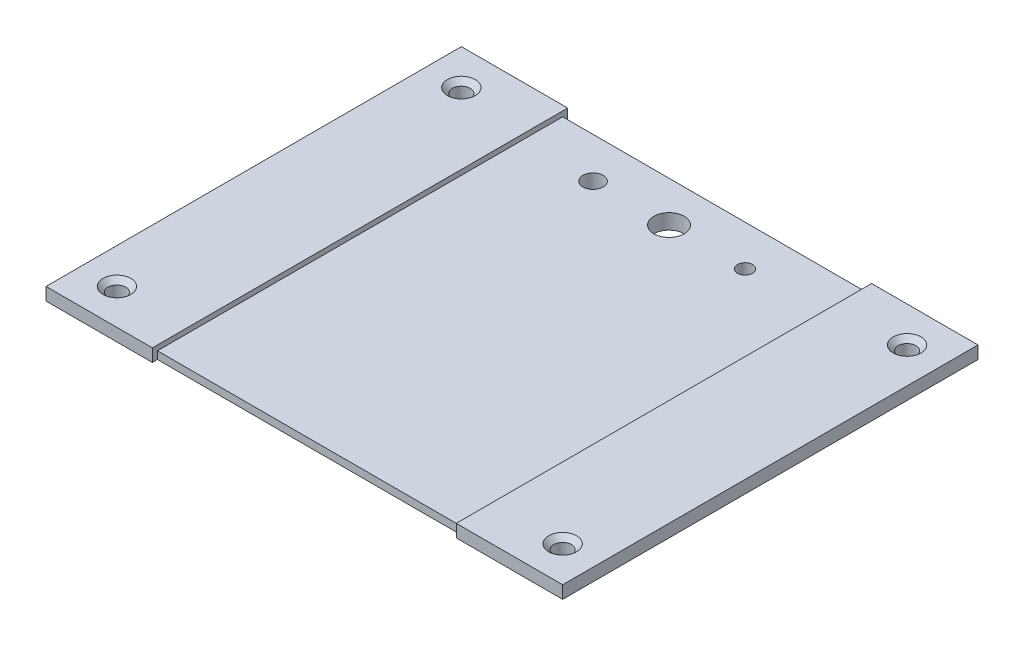
from build123d import *

# Parameters (mm, degrees)
ESQUISSE1_W             = 102
ESQUISSE1_H             = 80
BOSS_EXTRU_1_DEPTH      = 1.5
ESQUISSE2_W             = 96
ESQUISSE2_H             = 76
BOSS_EXTRU_2_DEPTH      = 1.5
ESQUISSE3_R             = 1.75
ESQUISSE3_R_2           = 2
ESQUISSE3_R_3           = 3
ESQUISSE3_R_4           = 1.5
ENL_V_MAT_EXTRU_1_DEPTH = 5
BOSS_EXTRU_5_START      = 1
ESQUISSE6_W             = 21
ESQUISSE6_H             = 80
ESQUISSE6_R             = 1.75
BOSS_EXTRU_5_DEPTH      = 1
CHANFREIN2_SIZE         = 1
ESQUISSE7_W             = 21
ESQUISSE7_H             = 2.5
BOSS_EXTRU_6_DEPTH      = 1
ESQUISSE8_W             = 21
ESQUISSE8_H             = 2.5
BOSS_EXTRU_7_DEPTH      = 1


with BuildPart() as part:
    # Esquisse1 → Boss.-Extru.1 (new body)
    with BuildSketch(Plane(origin=(0, 0, 0), x_dir=(1, 0, 0), z_dir=(0, 1, 0))):
        with Locations((51, 40)):
            Rectangle(ESQUISSE1_W, ESQUISSE1_H)
    extrude(amount=BOSS_EXTRU_1_DEPTH)

    # Esquisse2 → Boss.-Extru.2 (add)
    with BuildSketch(Plane.XZ):
        with Locations((51, -40)):
            Rectangle(ESQUISSE2_W, ESQUISSE2_H)
    extrude(amount=BOSS_EXTRU_2_DEPTH)

    # Esquisse3 → Enlèv. mat.-Extru.1 (cut)
    with BuildSketch(Plane(origin=(0, 1.5, 0), x_dir=(1, 0, 0), z_dir=(0, 1, 0))):
        with Locations((7, 74)):
            Circle(ESQUISSE3_R)
        with Locations((7, 6)):
            Circle(ESQUISSE3_R)
        with Locations((95, 6)):
            Circle(ESQUISSE3_R)
        with Locations((95, 74)):
            Circle(ESQUISSE3_R)
        with Locations((35, 72)):
            Circle(ESQUISSE3_R_2)
        with Locations((50, 72)):
            Circle(ESQUISSE3_R_3)
        with Locations((65, 72)):
            Circle(ESQUISSE3_R_4)
    extrude(amount=-ENL_V_MAT_EXTRU_1_DEPTH, mode=Mode.SUBTRACT)

    # Esquisse6 → Boss.-Extru.5 (add)
    # profile 1 of 2: a face of its own
    with BuildSketch(Plane(origin=(0, 1.5, 0), x_dir=(1, 0, 0), z_dir=(0, 1, 0)).offset(BOSS_EXTRU_5_START)):
        with Locations((91.5, 40)):
            Rectangle(ESQUISSE6_W, ESQUISSE6_H)
        with Locations((95, 6)):
            Circle(ESQUISSE6_R, mode=Mode.SUBTRACT)
        with Locations((95, 74)):
            Circle(ESQUISSE6_R, mode=Mode.SUBTRACT)
    # profile 2 of 2: a face of its own
    with BuildSketch(Plane(origin=(0, 1.5, 0), x_dir=(1, 0, 0), z_dir=(0, 1, 0)).offset(BOSS_EXTRU_5_START)):
        with Locations((10.5, 40)):
            Rectangle(ESQUISSE6_W, ESQUISSE6_H)
        with Locations((7, 74)):
            Circle(ESQUISSE6_R, mode=Mode.SUBTRACT)
        with Locations((7, 6)):
            Circle(ESQUISSE6_R, mode=Mode.SUBTRACT)
    extrude(amount=-BOSS_EXTRU_5_DEPTH)

    # Chanfrein2
    chanfrein2_edges = [part.edges().sort_by_distance(p)[0] for p in [
        (5.25, 2.5, -74),
        (5.25, 2.5, -6),
        (93.25, 2.5, -6),
        (93.25, 2.5, -74),
    ]]
    chamfer(chanfrein2_edges, length=CHANFREIN2_SIZE)

    # Esquisse7 → Boss.-Extru.6 (add)
    with BuildSketch(Plane.XY):
        with Locations((10.5, 1.25)):
            Rectangle(ESQUISSE7_W, ESQUISSE7_H)
        with Locations((91.5, 1.25)):
            Rectangle(ESQUISSE7_W, ESQUISSE7_H)
    extrude(amount=BOSS_EXTRU_6_DEPTH)

    # Esquisse8 → Boss.-Extru.7 (add)
    with BuildSketch(Plane(origin=(0, 0, -80), x_dir=(-1, 0, 0), z_dir=(0, 0, -1))):
        with Locations((-91.5, 1.25)):
            Rectangle(ESQUISSE8_W, ESQUISSE8_H)
        with Locations((-10.5, 1.25)):
            Rectangle(ESQUISSE8_W, ESQUISSE8_H)
    extrude(amount=BOSS_EXTRU_7_DEPTH)


solid = part.part
